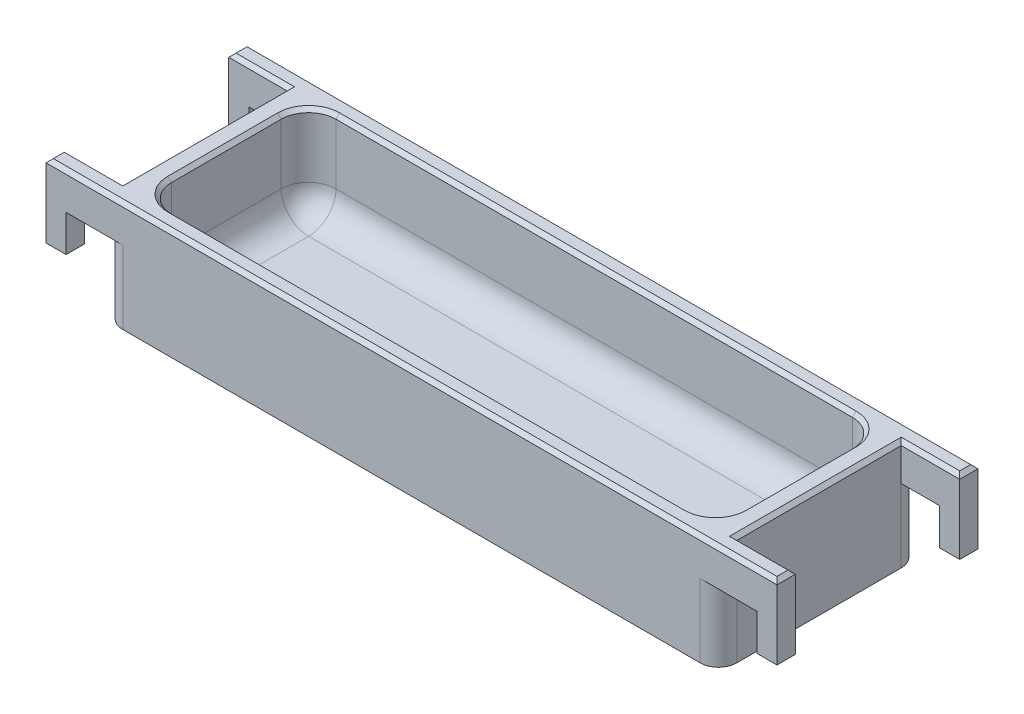
from build123d import *

# Parameters (mm, degrees)
BOSS_EXTRUDE1_DEPTH                      = 30
CUT_EXTRUDE1_DEPTH                       = 5
MIRROR1_AT_THE_SECOND_PLANE_COPY_1_DEPTH = 5
SKETCH4_W                                = 156.298932384
SKETCH4_H                                = 45
BOSS_EXTRUDE2_DEPTH                      = 5
FILLET1_R                                = 7.5
FILLET2_R                                = 5
CHAMFER1_SIZE                            = 1


with BuildPart() as part:
    # Sketch1 → Boss-Extrude1 (new body)
    with BuildSketch(Plane(origin=(0, 0, 0), x_dir=(1, 0, 0), z_dir=(0, 1, 0))):
        Polygon((-84, 25), (-84, -15), (-84, -20), (-100, -20), (-100, -25), (100, -25), (100, -20), (84, -20), (84, -15), (84, 25), (100, 25), (100, 30), (-100, 30), (-100, 25), align=None)
        Polygon((78.149466192, -20), (-78.149466192, -20), (-78.149466192, -15), (-78.149466192, 25), (78.149466192, 25), (78.149466192, -15), align=None, mode=Mode.SUBTRACT)
    extrude(amount=BOSS_EXTRUDE1_DEPTH)

    # Sketch3 → Cut-Extrude1 (cut)
    with BuildSketch(Plane.XY.offset(-25)):
        Polygon((-84, 0), (-94.5, 0), (-100, 0), (-100, 10), (-94.5, 10), (-94.5, 11.680506992), (-94.5, 20), (-84, 20), align=None)
    cut_extrude1 = extrude(amount=-CUT_EXTRUDE1_DEPTH, mode=Mode.SUBTRACT)

    # Mirror1: Cut-Extrude1 across plane
    add(cut_extrude1.mirror(Plane.XY.offset(-2.5)), mode=Mode.SUBTRACT)

    # Mirror1 at the second plane: Cut-Extrude1 across plane
    add(cut_extrude1.mirror(Plane(origin=(0, 0, 0), x_dir=(0, 0, 1), z_dir=(1, 0, 0))), mode=Mode.SUBTRACT)

    # Mirror1 at the second plane copy 1 sketc → Mirror1 at the second plane copy 1 (cut)
    with BuildSketch(Plane(origin=(0, 0, 20), x_dir=(-1, 0, 0), z_dir=(0, 0, -1))):
        Polygon((-84, 0), (-94.5, 0), (-100, 0), (-100, 10), (-94.5, 10), (-94.5, 11.680506992), (-94.5, 20), (-84, 20), align=None)
    extrude(amount=-MIRROR1_AT_THE_SECOND_PLANE_COPY_1_DEPTH, mode=Mode.SUBTRACT)

    # Sketch4 → Boss-Extrude2 (add)
    with BuildSketch(Plane.XZ):
        with Locations((0, -2.5)):
            Rectangle(SKETCH4_W, SKETCH4_H)
    extrude(amount=-BOSS_EXTRUDE2_DEPTH)

    # Fillet1
    fillet1_edges = [part.edges().sort_by_distance(p)[0] for p in [
        (0, 5, -25),
        (78.149466192, 5, -2.5),
        (-78.149466192, 5, -2.5),
        (78.149466192, 17.5, -25),
        (-78.149466192, 17.5, -25),
        (0, 5, 20),
        (-78.149466192, 17.5, 20),
        (78.149466192, 17.5, 20),
    ]]
    fillet(fillet1_edges, radius=FILLET1_R)

    # Fillet2
    fillet2_edges = [part.edges().sort_by_distance(p)[0] for p in [
        (84, 10, -30),
        (-84, 10, -30),
        (84, 10, 25),
        (-84, 10, 25),
    ]]
    fillet(fillet2_edges, radius=FILLET2_R)

    # Chamfer1
    chamfer1_edges = [part.edges().sort_by_distance(p)[0] for p in [
        (100, 30, 22.5),
        (0, 30, 25),
        (-100, 30, 22.5),
        (-92, 30, 20),
        (-84, 30, -2.5),
        (-92, 30, -25),
        (-100, 30, -27.5),
        (0, 30, -30),
        (100, 30, -27.5),
        (92, 30, -25),
        (84, 30, -2.5),
        (92, 30, 20),
        (75.952767051, 30, -22.803300859),
        (0, 30, -25),
        (-75.952767051, 30, -22.803300859),
        (-78.149466192, 30, -2.5),
        (-75.952767051, 30, 17.803300859),
        (0, 30, 20),
        (75.952767051, 30, 17.803300859),
        (78.149466192, 30, -2.5),
    ]]
    chamfer(chamfer1_edges, length=CHAMFER1_SIZE)


solid = part.part
